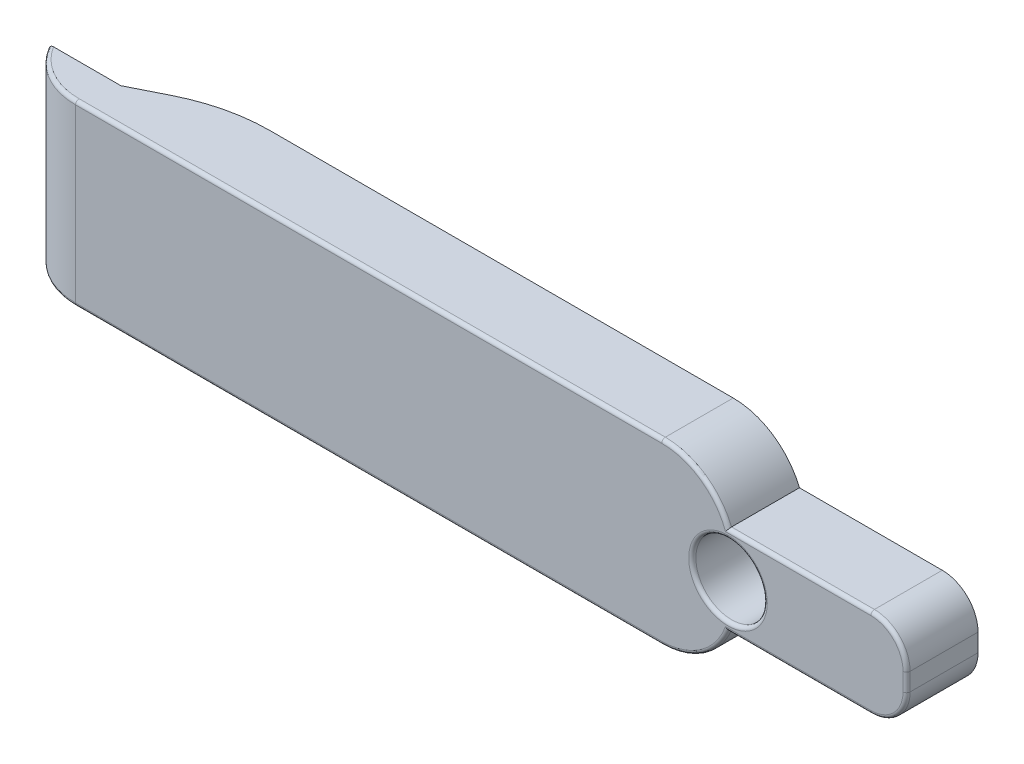
from build123d import *

# Parameters (mm, degrees)
SKETCH1_W           = 250
SKETCH1_H           = 25
BOSS_EXTRUDE3_DEPTH = 20
SKETCH4_R           = 10
CUT_EXTRUDE3_DEPTH  = 20
SKETCH6_W           = 200
SKETCH6_H           = 20
BOSS_EXTRUDE4_DEPTH = 12.5
SKETCH7_W           = 200
SKETCH7_H           = 20
BOSS_EXTRUDE5_DEPTH = 12.5
CUT_EXTRUDE8_DEPTH  = 137.106575888
FILLET10_R          = 20
FILLET11_R          = 20
FILLET12_R          = 10
FILLET13_R          = 50
FILLET15_R          = 1


with BuildPart() as part:
    # Sketch1 → Boss-Extrude3 (new body)
    with BuildSketch(Plane.XY):
        Rectangle(SKETCH1_W, SKETCH1_H)
    extrude(amount=BOSS_EXTRUDE3_DEPTH)

    # Sketch4 → Cut-Extrude3 (cut)
    with BuildSketch(Plane.XY.offset(20)):
        with Locations((75, 0)):
            Circle(SKETCH4_R)
    extrude(amount=-CUT_EXTRUDE3_DEPTH, mode=Mode.SUBTRACT)

    # Sketch6 → Boss-Extrude4 (add)
    with BuildSketch(Plane(origin=(0, 12.5, 0), x_dir=(1, 0, 0), z_dir=(0, 1, 0))):
        with Locations((-25, -10)):
            Rectangle(SKETCH6_W, SKETCH6_H)
    extrude(amount=BOSS_EXTRUDE4_DEPTH)

    # Sketch7 → Boss-Extrude5 (add)
    with BuildSketch(Plane.XZ.offset(12.5)):
        with Locations((-25, 10)):
            Rectangle(SKETCH7_W, SKETCH7_H)
    extrude(amount=BOSS_EXTRUDE5_DEPTH)

    # Sketch8 → Cut-Extrude8 (cut, through all)
    with BuildSketch(Plane(origin=(0, 25, 0), x_dir=(1, 0, 0), z_dir=(0, 1, 0))):
        Polygon((-85, 0), (-125, 0), (-125, -10), (-105, -10), align=None)
    extrude(amount=-CUT_EXTRUDE8_DEPTH, mode=Mode.SUBTRACT)

    # Fillet10
    # the kernel refuses this fillet: 20 mm, written as the material it takes off along each edge
    with BuildSketch(Plane(origin=(-125, 68.301270189, 20), x_dir=(1, 0, 0), z_dir=(0, -1, 0))) as fillet10_piece_1:
        with BuildLine():
            CenterArc((17.320508076, -20), FILLET10_R, 90, 60)
            Line((0, -10), (-0.346410162, -9.8))
            ThreePointArc((-0.346410162, -9.8), (-0.4, -5), (-0.4, 0))
            Line((-0.4, 0), (0, 0.4))
            Line((0, 0.4), (17.320508076, 0.4))
            Line((17.320508076, 0.4), (17.320508076, 0))
        make_face()
    extrude(amount=136.602540378, mode=Mode.SUBTRACT)

    # Fillet11
    # the kernel refuses this fillet: 20 mm, written as the material it takes off along each edge
    with BuildSketch(Plane(origin=(75, -25, 66.351240544), x_dir=(-1, 0, 0), z_dir=(0, 0, -1))) as fillet11_piece_1:
        with BuildLine():
            CenterArc((18.540496218, 20), FILLET11_R, 202.024312837, 67.975687163)
            Line((0, 12.5), (-0.370809924, 12.35))
            ThreePointArc((-0.370809924, 12.35), (-0.4, 6.25), (-0.4, 0))
            Line((-0.4, 0), (0, -0.4))
            Line((0, -0.4), (18.540496218, -0.4))
            Line((18.540496218, -0.4), (18.540496218, 0))
        make_face()
    extrude(amount=112.702481089, mode=Mode.SUBTRACT)
    with BuildSketch(Plane(origin=(75, 25, -46.351240544), x_dir=(0, -1, 0), z_dir=(0, 0, 1))) as fillet11_piece_2:
        with BuildLine():
            CenterArc((20, -18.540496218), FILLET11_R, 112.024312837, 67.975687163)
            Line((0, -18.540496218), (-0.4, -18.540496218))
            Line((-0.4, -18.540496218), (-0.4, 0))
            Line((-0.4, 0), (0, 0.4))
            ThreePointArc((0, 0.4), (6.25, 0.4), (12.35, 0.370809924))
            Line((12.35, 0.370809924), (12.5, 0))
        make_face()
    extrude(amount=112.702481089, mode=Mode.SUBTRACT)

    # Fillet12
    fillet12_edges = [part.edges().sort_by_distance(p)[0] for p in [
        (125, -12.5, 10),
        (125, 12.5, 10),
    ]]
    fillet(fillet12_edges, radius=FILLET12_R)

    # Fillet13
    fillet13_edges = [part.edges().sort_by_distance(p)[0] for p in [
        (-85, 0, 0),
    ]]
    fillet(fillet13_edges, radius=FILLET13_R)

    # Fillet15
    fillet15_edges = [part.edges().sort_by_distance(p)[0] for p in [
        (65, 0, 20),
        (95, -12.5, 20),
        (-25.609994071, 25, 20),
        (-117.679491924, -25, 17.320508076),
        (-117.679491924, 25, 17.320508076),
        (-25.609994071, -25, 20),
        (67.63984367, 21.583123952, 20),
        (67.63984367, -21.583123952, 20),
        (95, 12.5, 20),
        (125, 0, 20),
        (122.071067812, -9.571067812, 20),
        (122.071067812, 9.571067812, 20),
    ]]
    fillet(fillet15_edges, radius=FILLET15_R)


solid = part.part
